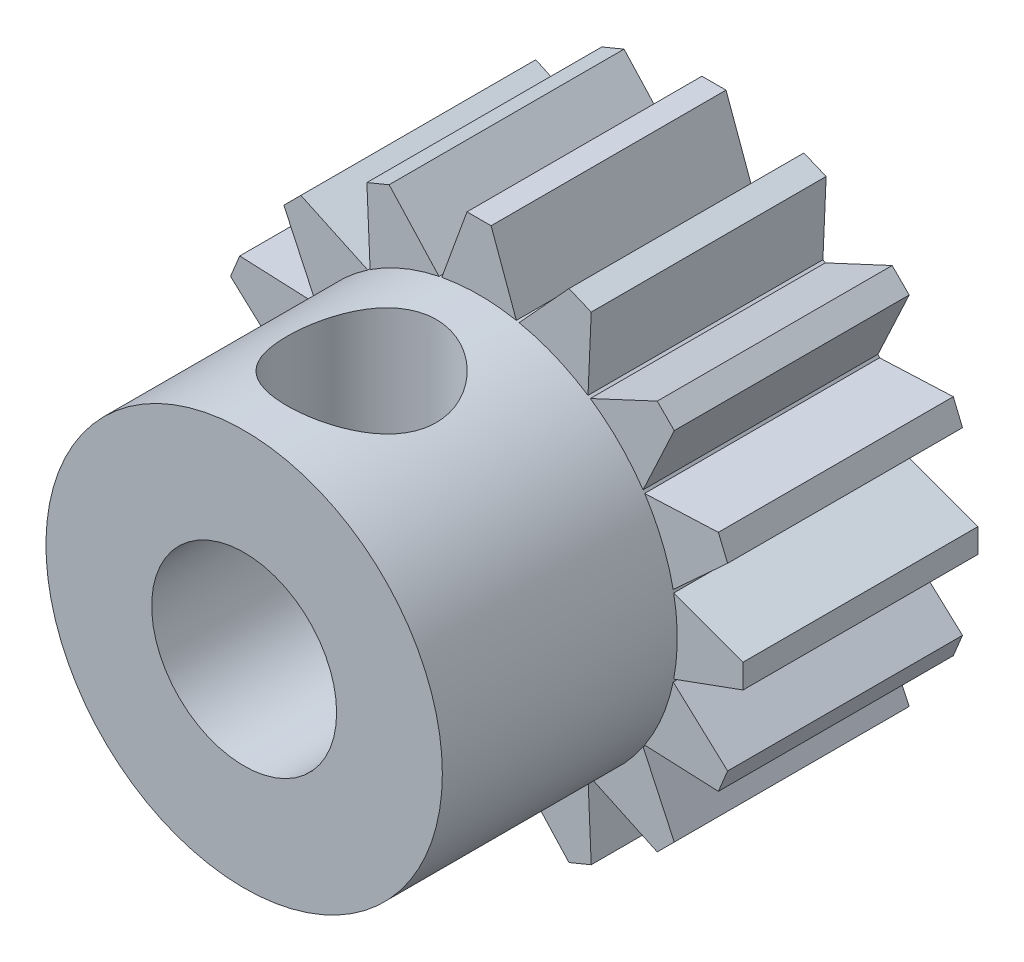
from build123d import *

# Parameters (mm, degrees)
BOSS_EXTRUDE1_DEPTH    = 6.35
SKETCH2_R              = 5.357812451
BOSS_EXTRUDE2_DEPTH    = 6.35
F_10_CLEARANCE_HOLE1_D = 5
SKETCH5_W              = 2.0193
SKETCH5_H              = 5.66348411


with BuildPart() as part:
    # Sketch1 → Boss-Extrude1 (new body)
    with BuildSketch(Plane(origin=(0, 0, -3.175), x_dir=(-1, 0, 0), z_dir=(0, 0, -1))):
        with BuildLine():
            Line((-4.475719216, 2.94518093), (-6.469475121, 3.032230191))
            Line((-6.469475121, 3.032230191), (-6.718720366, 2.430498941))
            Line((-6.718720366, 2.430498941), (-5.247368905, 1.082253729))
            ThreePointArc((-5.247368905, 1.082253729), (-5.25486353, 1.045257315), (-5.262097316, 1.008209016))
            Line((-5.262097316, 1.008209016), (-7.137399981, 0.325654666))
            Line((-7.137399981, 0.325654666), (-7.137399981, -0.325654551))
            Line((-7.137399981, -0.325654551), (-5.262097381, -1.008208899))
            ThreePointArc((-5.262097381, -1.008208899), (-5.254863555, -1.045257412), (-5.247368888, -1.08225404))
            Line((-5.247368888, -1.08225404), (-6.718720366, -2.43049927))
            Line((-6.718720366, -2.43049927), (-6.469475121, -3.03223052))
            Line((-6.469475121, -3.03223052), (-4.475719151, -2.945181254))
            ThreePointArc((-4.475719151, -2.945181254), (-4.454858201, -2.97664122), (-4.433776122, -3.007953433))
            Line((-4.433776122, -3.007953433), (-5.277176571, -4.816631533))
            Line((-5.277176571, -4.816631533), (-4.816631353, -5.277176632))
            Line((-4.816631353, -5.277176632), (-3.007953331, -4.433776241))
            ThreePointArc((-3.007953331, -4.433776241), (-2.976641072, -4.454858352), (-2.945181059, -4.475719332))
            Line((-2.945181059, -4.475719332), (-3.032230324, -6.469475317))
            Line((-3.032230324, -6.469475317), (-2.430499074, -6.718720562))
            Line((-2.430499074, -6.718720562), (-1.082253821, -5.247369057))
            ThreePointArc((-1.082253821, -5.247369057), (-1.045257355, -5.254863691), (-1.008209005, -5.262097487))
            Line((-1.008209005, -5.262097487), (-0.325654634, -7.137400208))
            Line((-0.325654634, -7.137400208), (0.325654583, -7.137400208))
            Line((0.325654583, -7.137400208), (1.008208941, -5.262097516))
            ThreePointArc((1.008208941, -5.262097516), (1.045257356, -5.254863709), (1.082253886, -5.247369061))
            Line((1.082253886, -5.247369061), (2.430499137, -6.718720562))
            Line((2.430499137, -6.718720562), (3.032230387, -6.469475317))
            Line((3.032230387, -6.469475317), (2.945181121, -4.475719349))
            ThreePointArc((2.945181121, -4.475719349), (2.976641089, -4.454858399), (3.007953303, -4.433776319))
            Line((3.007953303, -4.433776319), (4.8166314, -5.277176767))
            Line((4.8166314, -5.277176767), (5.277176499, -4.816631549))
            Line((5.277176499, -4.816631549), (4.433776123, -3.007953559))
            ThreePointArc((4.433776123, -3.007953559), (4.454858245, -2.976641285), (4.475719236, -2.945181257))
            Line((4.475719236, -2.945181257), (6.469475184, -3.03223052))
            Line((6.469475184, -3.03223052), (6.718720429, -2.43049927))
            Line((6.718720429, -2.43049927), (5.247368971, -1.08225406))
            ThreePointArc((5.247368971, -1.08225406), (5.254863613, -1.045257562), (5.262097415, -1.008209179))
            Line((5.262097415, -1.008209179), (7.137400075, -0.32565483))
            Line((7.137400075, -0.32565483), (7.137400075, 0.325654387))
            Line((7.137400075, 0.325654387), (5.26209746, 1.008208717))
            ThreePointArc((5.26209746, 1.008208717), (5.254863645, 1.045257174), (5.247368989, 1.082253746))
            Line((5.247368989, 1.082253746), (6.718720429, 2.430498941))
            Line((6.718720429, 2.430498941), (6.469475184, 3.032230191))
            Line((6.469475184, 3.032230191), (4.475719304, 2.945180929))
            ThreePointArc((4.475719304, 2.945180929), (4.454858329, 2.976640935), (4.433776224, 3.007953186))
            Line((4.433776224, 3.007953186), (5.277176634, 4.816631204))
            Line((5.277176634, 4.816631204), (4.816631416, 5.277176303))
            Line((4.816631416, 5.277176303), (3.007953499, 4.433775961))
            ThreePointArc((3.007953499, 4.433775961), (2.976641191, 4.454858106), (2.945181127, 4.47571912))
            Line((2.945181127, 4.47571912), (3.032230387, 6.469474988))
            Line((3.032230387, 6.469474988), (2.430499137, 6.718720233))
            Line((2.430499137, 6.718720233), (1.082253963, 5.24736882))
            ThreePointArc((1.082253963, 5.24736882), (1.045257437, 5.254863468), (1.008209026, 5.262097275))
            Line((1.008209026, 5.262097275), (0.325654697, 7.137399816))
            Line((0.325654697, 7.137399816), (-0.32565452, 7.137399816))
            Line((-0.32565452, 7.137399816), (-1.008208848, 5.262097292))
            ThreePointArc((-1.008208848, 5.262097292), (-1.045257316, 5.254863474), (-1.082253899, 5.247368816))
            Line((-1.082253899, 5.247368816), (-2.430499074, 6.718720233))
            Line((-2.430499074, 6.718720233), (-3.032230324, 6.469474988))
            Line((-3.032230324, 6.469474988), (-2.945181062, 4.475719106))
            ThreePointArc((-2.945181062, 4.475719106), (-2.976641066, 4.454858131), (-3.007953316, 4.433776026))
            Line((-3.007953316, 4.433776026), (-4.816631337, 5.277176438))
            Line((-4.816631337, 5.277176438), (-5.277176436, 4.81663122))
            Line((-5.277176436, 4.81663122), (-4.433776079, 3.007953271))
            ThreePointArc((-4.433776079, 3.007953271), (-4.454858213, 2.976640978), (-4.475719216, 2.94518093))
        make_face()
    extrude(amount=-BOSS_EXTRUDE1_DEPTH)

    # Sketch2 → Boss-Extrude2 (add)
    with BuildSketch(Plane.XY.offset(3.175)):
        with Locations((-1.2e-08, 5.2e-08)):
            Circle(SKETCH2_R)
    extrude(amount=BOSS_EXTRUDE2_DEPTH)

    # #10 Clearance Hole1 (through all)
    with Locations(Plane.XY.offset(9.525)):
        with Locations((0, 0)):
            Hole(F_10_CLEARANCE_HOLE1_D / 2)

    # Sketch5 → #21 (0.159) Diameter Hole1 (revolve, cut)
    with BuildSketch(Plane(origin=(0, 1.473915707, 6.35), x_dir=(0, 0, -1), z_dir=(1, 0, 0))):
        with Locations((1.00965, 2.831742055)):
            Rectangle(SKETCH5_W, SKETCH5_H)
    revolve(axis=Axis((0, -4.876084293, 6.35), (0, 1, 0)), mode=Mode.SUBTRACT)


solid = part.part
